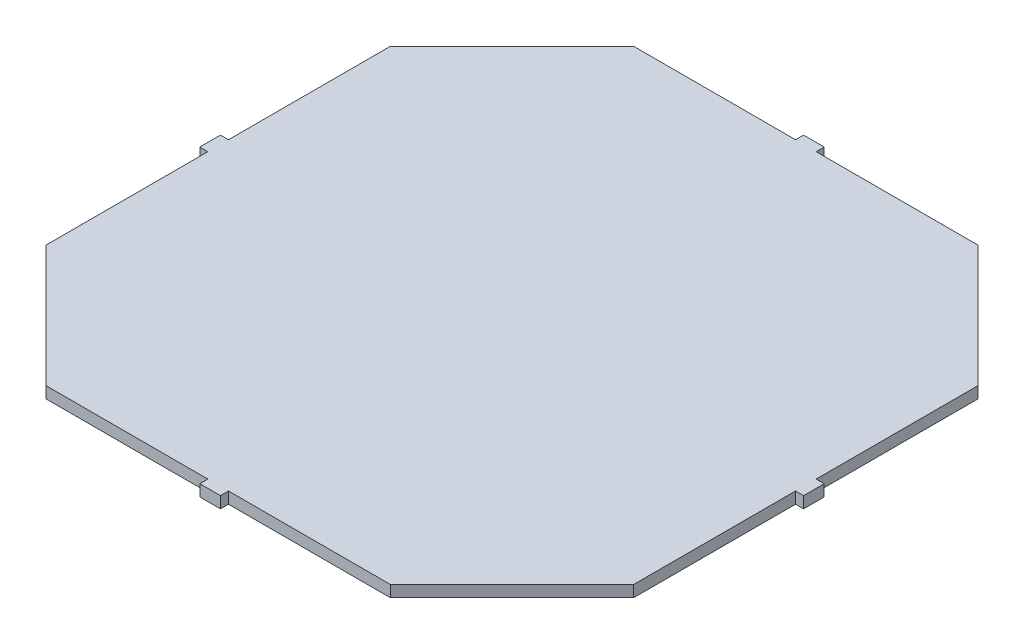
from build123d import *

# Parameters (mm, degrees)
BOSS_EXTRUDE1_DEPTH = 1
SKETCH2_W           = 0.7
SKETCH2_H           = 1.8
SKETCH2_W_2         = 1.8
SKETCH2_H_2         = 0.7
BOSS_EXTRUDE2_DEPTH = 1


with BuildPart() as part:
    # Sketch1 → Boss-Extrude1 (new body)
    with BuildSketch(Plane(origin=(0, 0, 0), x_dir=(1, 0, 0), z_dir=(0, 1, 0))):
        Polygon((-25.606601718, 15), (-15, 25.606601718), (15, 25.606601718), (25.606601718, 15), (25.606601718, -15), (15, -25.606601718), (-15, -25.606601718), (-25.606601718, -15), align=None)
    extrude(amount=BOSS_EXTRUDE1_DEPTH)

    # Sketch2 → Boss-Extrude2 (add)
    with BuildSketch(Plane(origin=(0, 1, 0), x_dir=(1, 0, 0), z_dir=(0, 1, 0))):
        with Locations((-25.956601718, 0)):
            Rectangle(SKETCH2_W, SKETCH2_H)
        with Locations((0, 25.956601718)):
            Rectangle(SKETCH2_W_2, SKETCH2_H_2)
        with Locations((0, -25.956601718)):
            Rectangle(SKETCH2_W_2, SKETCH2_H_2)
        with Locations((25.956601718, 0)):
            Rectangle(SKETCH2_W, SKETCH2_H)
    extrude(amount=-BOSS_EXTRUDE2_DEPTH)


solid = part.part
